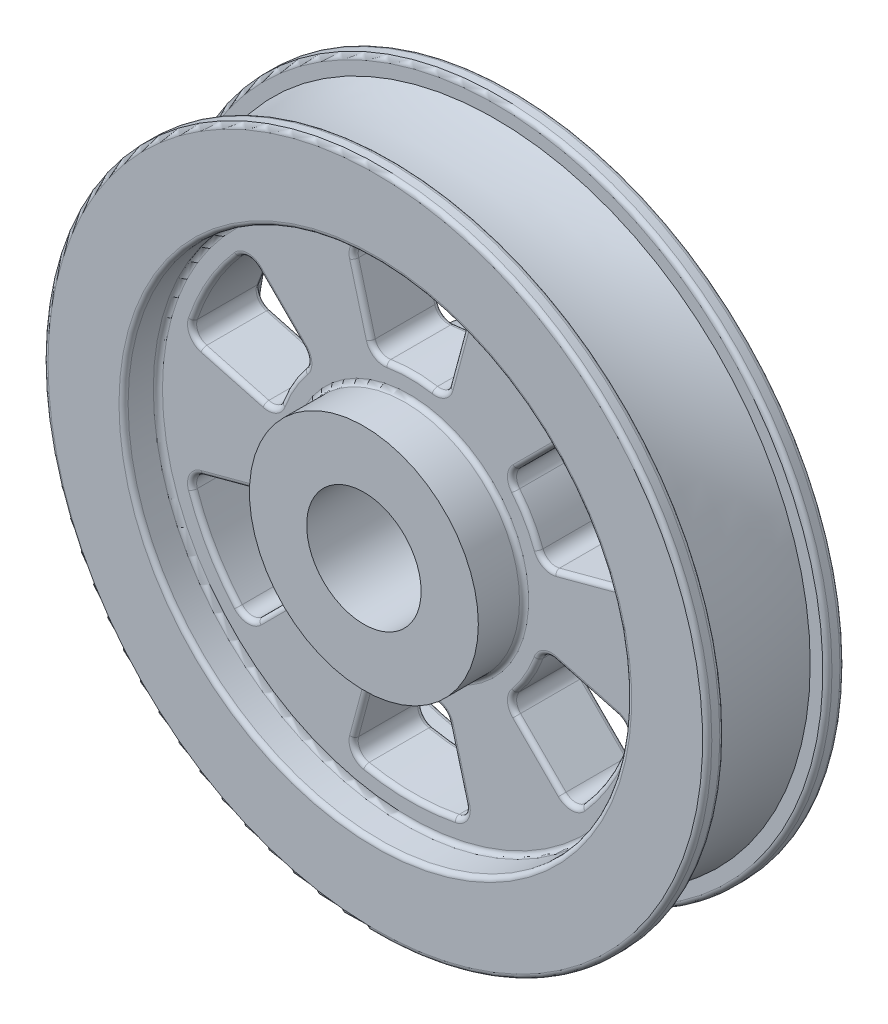
from build123d import *

# Parameters (mm, degrees)
SPOKE_HOLE_DEPTH             = 269.057260674
SPOKE_HOLE_PATTERN_COUNT     = 6
F_0_10_INCH_FILLETS_ROUNDS_R = 2.54


with BuildPart() as part:
    # Wheel Cross-section → Revolve1 (revolve)
    with BuildSketch(Plane(origin=(0, 0, 0), x_dir=(0, 0, -1), z_dir=(1, 0, 0))):
        with BuildLine():
            Line((44.45, 31.75), (44.45, 63.5))
            Line((44.45, 63.5), (19.05, 63.5))
            Line((19.05, 63.5), (19.05, 139.7))
            Line((19.05, 139.7), (38.1, 139.7))
            Line((38.1, 139.7), (38.1, 184.15))
            Line((38.1, 184.15), (28.575, 184.15))
            Line((28.575, 184.15), (28.575, 174.625))
            ThreePointArc((28.575, 174.625), (0, 171.922125473), (-28.575, 174.625))
            Line((-28.575, 174.625), (-28.575, 184.15))
            Line((-28.575, 184.15), (-38.1, 184.15))
            Line((-38.1, 184.15), (-38.1, 139.7))
            Line((-38.1, 139.7), (-19.05, 139.7))
            Line((-19.05, 139.7), (-19.05, 63.5))
            Line((-19.05, 63.5), (-44.45, 63.5))
            Line((-44.45, 63.5), (-44.45, 31.75))
            Line((-44.45, 31.75), (44.45, 31.75))
        make_face()
    revolve(axis=Axis((0, 0, 130.774722222), (0, 0, -1)))

    # Spoke cut-out → Spoke hole (cut, through all)
    with BuildSketch(Plane.XY.offset(19.05)):
        with BuildLine():
            Line((30.834810774, 115.077080449), (21.604380868, 80.628647064))
            ThreePointArc((21.604380868, 80.628647064), (18.350350621, 76.181930935), (12.94911461, 75.09168017))
            ThreePointArc((12.94911461, 75.09168017), (0, 76.2), (-12.94911461, 75.09168017))
            ThreePointArc((-12.94911461, 75.09168017), (-18.350350621, 76.181930935), (-21.604380868, 80.628647064))
            Line((-21.604380868, 80.628647064), (-30.834810774, 115.077080449))
            ThreePointArc((-30.834810774, 115.077080449), (-29.948546686, 121.068056198), (-24.972825508, 124.520512311))
            ThreePointArc((-24.972825508, 124.520512311), (0, 127), (24.972825508, 124.520512311))
            ThreePointArc((24.972825508, 124.520512311), (29.948546686, 121.068056198), (30.834810774, 115.077080449))
        make_face()
    spoke_hole = extrude(amount=-SPOKE_HOLE_DEPTH, mode=Mode.SUBTRACT)

    # Spoke hole pattern: Spoke hole ×6 about axis
    spoke_hole_pattern_axis = Axis((0, 0, 130.774722222), (0, 0, -1))
    for i in range(1, SPOKE_HOLE_PATTERN_COUNT):
        add(spoke_hole.rotate(spoke_hole_pattern_axis, i * 360 / SPOKE_HOLE_PATTERN_COUNT), mode=Mode.SUBTRACT)

    # 0.10 inch Fillets & Rounds
    f_0_10_inch_fillets_rounds_edges = [part.edges().sort_by_distance(p)[0] for p in [
        (-89.873738911, -86.470230336, -19.05),
        (-109.985226281, -63.5, -19.05),
        (-119.822285597, -34.597825862, -19.05),
        (-97.852863756, -26.219595821, -19.05),
        (-75.15066281, -22.199095661, -19.05),
        (-65.991135768, -38.1, -19.05),
        (-56.800312189, -53.982835274, -19.05),
        (-18.350350621, -76.181930935, -19.05),
        (0, -76.2, -19.05),
        (18.350350621, -76.181930935, -19.05),
        (26.219595821, -97.852863756, -19.05),
        (29.948546686, -121.068056198, -19.05),
        (0, -127, -19.05),
        (-29.948546686, -121.068056198, -19.05),
        (119.822285597, -34.597825862, -19.05),
        (109.985226281, -63.5, -19.05),
        (89.873738911, -86.470230336, -19.05),
        (71.633267936, -71.633267936, -19.05),
        (56.800312189, -53.982835274, -19.05),
        (65.991135768, -38.1, -19.05),
        (75.15066281, -22.199095661, -19.05),
        (89.873738911, 86.470230336, -19.05),
        (109.985226281, 63.5, -19.05),
        (119.822285597, 34.597825862, -19.05),
        (97.852863756, 26.219595821, -19.05),
        (75.15066281, 22.199095661, -19.05),
        (65.991135768, 38.1, -19.05),
        (56.800312189, 53.982835274, -19.05),
        (-29.948546686, 121.068056198, -19.05),
        (0, 127, -19.05),
        (29.948546686, 121.068056198, -19.05),
        (26.219595821, 97.852863756, -19.05),
        (18.350350621, 76.181930935, -19.05),
        (0, 76.2, -19.05),
        (-18.350350621, 76.181930935, -19.05),
        (-119.822285597, 34.597825862, -19.05),
        (-109.985226281, 63.5, -19.05),
        (-89.873738911, 86.470230336, -19.05),
        (-71.633267936, 71.633267936, -19.05),
        (-56.800312189, 53.982835274, -19.05),
        (-65.991135768, 38.1, -19.05),
        (-75.15066281, 22.199095661, -19.05),
        (18.350350621, 76.181930935, 19.05),
        (0, 76.2, 19.05),
        (-18.350350621, 76.181930935, 19.05),
        (-26.219595821, 97.852863756, 19.05),
        (-29.948546686, 121.068056198, 19.05),
        (0, 127, 19.05),
        (29.948546686, 121.068056198, 19.05),
        (75.15066281, 22.199095661, 19.05),
        (65.991135768, 38.1, 19.05),
        (56.800312189, 53.982835274, 19.05),
        (71.633267936, 71.633267936, 19.05),
        (89.873738911, 86.470230336, 19.05),
        (109.985226281, 63.5, 19.05),
        (119.822285597, 34.597825862, 19.05),
        (56.800312189, -53.982835274, 19.05),
        (65.991135768, -38.1, 19.05),
        (75.15066281, -22.199095661, 19.05),
        (97.852863756, -26.219595821, 19.05),
        (119.822285597, -34.597825862, 19.05),
        (109.985226281, -63.5, 19.05),
        (89.873738911, -86.470230336, 19.05),
        (-18.350350621, -76.181930935, 19.05),
        (0, -76.2, 19.05),
        (18.350350621, -76.181930935, 19.05),
        (26.219595821, -97.852863756, 19.05),
        (29.948546686, -121.068056198, 19.05),
        (0, -127, 19.05),
        (-29.948546686, -121.068056198, 19.05),
        (-119.822285597, -34.597825862, 19.05),
        (-97.852863756, -26.219595821, 19.05),
        (-75.15066281, -22.199095661, 19.05),
        (-65.991135768, -38.1, 19.05),
        (-56.800312189, -53.982835274, 19.05),
        (-71.633267936, -71.633267936, 19.05),
        (-89.873738911, -86.470230336, 19.05),
        (-89.873738911, 86.470230336, 19.05),
        (-71.633267936, 71.633267936, 19.05),
        (-56.800312189, 53.982835274, 19.05),
        (-65.991135768, 38.1, 19.05),
        (-75.15066281, 22.199095661, 19.05),
        (-97.852863756, 26.219595821, 19.05),
        (-119.822285597, 34.597825862, 19.05),
        (0, -184.15, -28.575),
        (0, -184.15, 28.575),
        (0, -184.15, 38.1),
        (0, -184.15, -38.1),
        (0, -139.7, -38.1),
        (0, -139.7, 38.1),
        (0, -139.7, -19.05),
        (-71.633267936, -71.633267936, -19.05),
        (-26.219595821, -97.852863756, -19.05),
        (97.852863756, -26.219595821, -19.05),
        (71.633267936, 71.633267936, -19.05),
        (-26.219595821, 97.852863756, -19.05),
        (-97.852863756, 26.219595821, -19.05),
        (0, -63.5, -19.05),
        (0, -139.7, 19.05),
        (0, -63.5, 19.05),
        (26.219595821, 97.852863756, 19.05),
        (97.852863756, 26.219595821, 19.05),
        (71.633267936, -71.633267936, 19.05),
        (-26.219595821, -97.852863756, 19.05),
        (-109.985226281, -63.5, 19.05),
        (-109.985226281, 63.5, 19.05),
    ]]
    fillet(f_0_10_inch_fillets_rounds_edges, radius=F_0_10_INCH_FILLETS_ROUNDS_R)


solid = part.part
